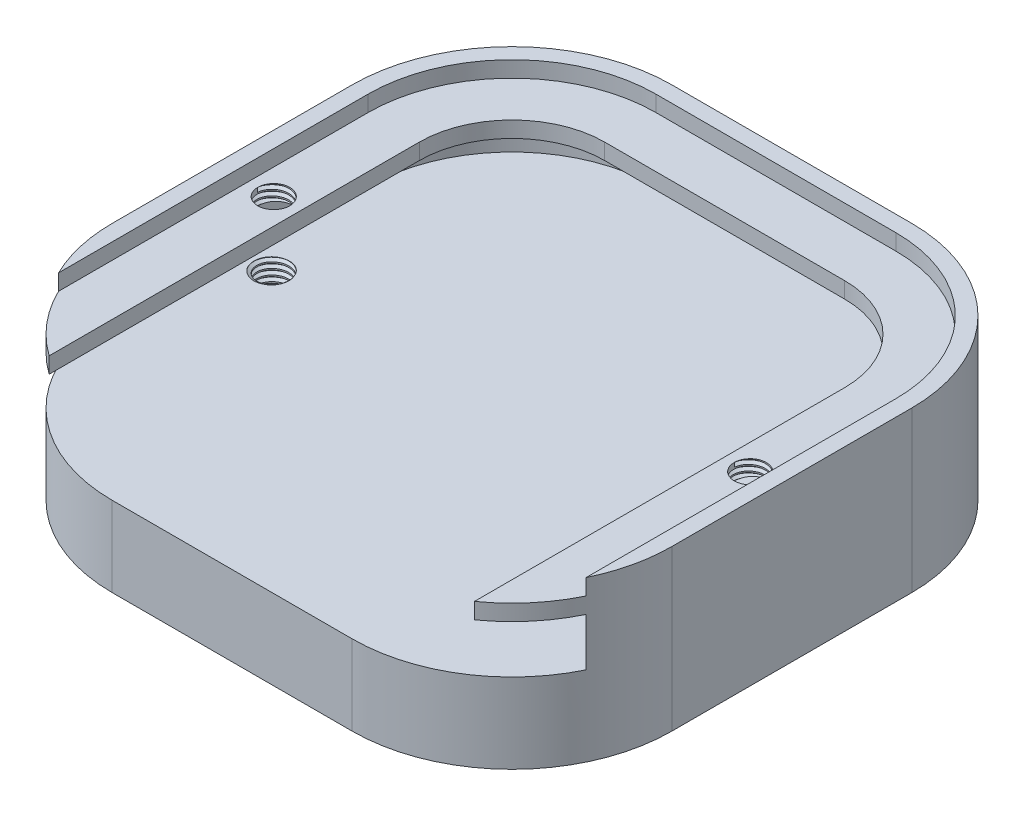
from build123d import *
from build123d.topology import SkipClean

# Parameters (mm, degrees)
BOSS_EXTRUDE1_DEPTH = 6.35
BOSS_EXTRUDE2_DEPTH = 6.35
BOSS_EXTRUDE3_START = -2.54
BOSS_EXTRUDE3_DEPTH = 1.27
SKETCH5_R           = 1.27
CUT_EXTRUDE2_DEPTH  = 10.16
THREAD4_PITCH       = 0.453571429
THREAD5_PITCH       = 0.453571429


with BuildPart() as part:
    # Sketch2 → Boss-Extrude1 (new body)
    with BuildSketch(Plane(origin=(0, 0, 0), x_dir=(1, 0, 0), z_dir=(0, 1, 0))):
        with BuildLine():
            Line((-9.525, 22.225), (9.525, 22.225))
            ThreePointArc((9.525, 22.225), (18.505256121, 18.505256121), (22.225, 9.525))
            Line((22.225, 9.525), (22.225, -9.525))
            ThreePointArc((22.225, -9.525), (18.505256121, -18.505256121), (9.525, -22.225))
            Line((9.525, -22.225), (-9.525, -22.225))
            ThreePointArc((-9.525, -22.225), (-18.505256121, -18.505256121), (-22.225, -9.525))
            Line((-22.225, -9.525), (-22.225, 9.525))
            ThreePointArc((-22.225, 9.525), (-18.505256121, 18.505256121), (-9.525, 22.225))
        make_face()
    extrude(amount=BOSS_EXTRUDE1_DEPTH)

    # Sketch3 → Boss-Extrude2 (add)
    with BuildSketch(Plane(origin=(0, 6.35, 0), x_dir=(1, 0, 0), z_dir=(0, 1, 0))):
        with BuildLine():
            Line((-9.525, 22.225), (9.525, 22.225))
            ThreePointArc((9.525, 22.225), (18.505256121, 18.505256121), (22.225, 9.525))
            Line((22.225, 9.525), (22.225, -9.525))
            ThreePointArc((22.225, -9.525), (21.903428818, -12.364806331), (20.955, -15.060801658))
            Line((20.955, -15.060801658), (20.955, 9.525))
            ThreePointArc((20.955, 9.525), (17.607230509, 17.607230509), (9.525, 20.955))
            Line((9.525, 20.955), (-9.525, 20.955))
            ThreePointArc((-9.525, 20.955), (-17.607230509, 17.607230509), (-20.955, 9.525))
            Line((-20.955, 9.525), (-20.955, -15.060801658))
            ThreePointArc((-20.955, -15.060801658), (-21.903428818, -12.364806331), (-22.225, -9.525))
            Line((-22.225, -9.525), (-22.225, 9.525))
            ThreePointArc((-22.225, 9.525), (-18.505256121, 18.505256121), (-9.525, 22.225))
        make_face()
    extrude(amount=BOSS_EXTRUDE2_DEPTH)

    # Sketch4 → Boss-Extrude3 (add)
    with BuildSketch(Plane(origin=(0, 12.7, 0), x_dir=(1, 0, 0), z_dir=(0, 1, 0)).offset(BOSS_EXTRUDE3_START)):
        with BuildLine():
            Line((-20.955, -15.060801658), (-20.955, 9.525))
            ThreePointArc((-20.955, 9.525), (-17.607230509, 17.607230509), (-9.525, 20.955))
            Line((-9.525, 20.955), (9.525, 20.955))
            ThreePointArc((9.525, 20.955), (17.607230509, 17.607230509), (20.955, 9.525))
            Line((20.955, 9.525), (20.955, -15.060801658))
            ThreePointArc((20.955, -15.060801658), (19.225825444, -17.721583782), (16.891, -19.870629222))
            Line((16.891, -19.870629222), (16.891, 9.525))
            ThreePointArc((16.891, 9.525), (14.73354855, 14.73354855), (9.525, 16.891))
            Line((9.525, 16.891), (-9.525, 16.891))
            ThreePointArc((-9.525, 16.891), (-14.73354855, 14.73354855), (-16.891, 9.525))
            Line((-16.891, 9.525), (-16.891, -19.870629222))
            ThreePointArc((-16.891, -19.870629222), (-19.225825444, -17.721583782), (-20.955, -15.060801658))
        make_face()
    extrude(amount=BOSS_EXTRUDE3_DEPTH)

    # Sketch5 → Cut-Extrude2 (cut)
    with BuildSketch(Plane(origin=(0, 11.43, 0), x_dir=(1, 0, 0), z_dir=(0, 1, 0))):
        with Locations(Location((-18.923, 0, 0), (0, 0, 270))):
            Circle(SKETCH5_R)
        with Locations(Location((18.923, 0, 0), (0, 0, 270))):
            Circle(SKETCH5_R)
    extrude(amount=-CUT_EXTRUDE2_DEPTH, mode=Mode.SUBTRACT)

    # Thread4: the profile of Thread Profile4 profile screwed along a right-hand helix of 22.4 turns, 6 arcs to a turn; built about Z, then put on its axis
    with SkipClean():  # the faces are left unmerged after this step: merging them gives an invalid solid
        thread4_z = Axis((0, 0, 0), (0, 0, 1))
        thread4_corners = [(1.2697, 0, -0.000173205), (1.515502736, 0, 0.141741071), (1.515502736, 0, 0.198437499), (1.2697, 0, 0.340351775)]
        with BuildLine(mode=Mode.PRIVATE) as thread4_profile:
            Line(thread4_corners[0], thread4_corners[1])
            Line(thread4_corners[1], thread4_corners[2])
            Line(thread4_corners[2], thread4_corners[3])
            Line(thread4_corners[3], thread4_corners[0])
        thread4_cap = Face(thread4_profile.wire())
        thread4_turn_angles = [0, 30, 60, 90, 120, 150, 180, 210, 240, 270, 300, 330, 360]
        thread4_turn_weights = [1, 0.8660254037844387, 1, 0.8660254037844387, 1, 0.8660254037844387, 1, 0.8660254037844387, 1, 0.8660254037844387, 1, 0.8660254037844387, 1]
        thread4_turn_rails = [Edge.make_bspline([Vector(p[0], p[1], 0).rotate(thread4_z, thread4_turn_angles[k]) / thread4_turn_weights[k] + Vector(0, 0, p[2] + THREAD4_PITCH * thread4_turn_angles[k] / 360) for k in range(13)], [0, 0, 0, 1, 1, 2, 2, 3, 3, 4, 4, 5, 5, 6, 6, 6], 2, thread4_turn_weights) for p in thread4_corners]
        thread4_turn_sides = [Face.make_surface_from_curves(thread4_turn_rails[p[0]], thread4_turn_rails[p[1]]) for p in [(0, 1), (1, 2), (2, 3), (3, 0)]]
        thread4_last_angles = [7920, 7950, 7980, 8010, 8040, 8052, 8064]
        thread4_last_weights = [1, 0.8660254037844387, 1, 0.8660254037844387, 1, 0.978147600733804, 1]
        thread4_last_rails = [Edge.make_bspline([Vector(p[0], p[1], 0).rotate(thread4_z, thread4_last_angles[k]) / thread4_last_weights[k] + Vector(0, 0, p[2] + THREAD4_PITCH * thread4_last_angles[k] / 360) for k in range(7)], [0, 0, 0, 1, 1, 2, 2, 3, 3, 3], 2, thread4_last_weights) for p in thread4_corners]
        thread4_last_sides = [Face.make_surface_from_curves(thread4_last_rails[p[0]], thread4_last_rails[p[1]]) for p in [(0, 1), (1, 2), (2, 3), (3, 0)]]
        thread4 = Plane(origin=(-18.923, 11.43, 0), x_dir=(-1, 0, 0), z_dir=(0, -1, 0)) * Solid(Shell([*[p.moved(Location((0, 0, THREAD4_PITCH * i))) for i in range(22) for p in thread4_turn_sides], *thread4_last_sides, thread4_cap, thread4_cap.rotate(thread4_z, 8064).moved(Location((0, 0, THREAD4_PITCH * 8064 / 360)))]))
        add(thread4, mode=Mode.SUBTRACT)

    # Thread5: the profile of Thread Profile5 profile screwed along a right-hand helix of 22.4 turns, 6 arcs to a turn; built about Z, then put on its axis
    with SkipClean():  # the faces are left unmerged after this step: merging them gives an invalid solid
        thread5_z = Axis((0, 0, 0), (0, 0, 1))
        thread5_corners = [(1.2697, 0, -0.000173205), (1.515502736, 0, 0.141741071), (1.515502736, 0, 0.198437499), (1.2697, 0, 0.340351775)]
        with BuildLine(mode=Mode.PRIVATE) as thread5_profile:
            Line(thread5_corners[0], thread5_corners[1])
            Line(thread5_corners[1], thread5_corners[2])
            Line(thread5_corners[2], thread5_corners[3])
            Line(thread5_corners[3], thread5_corners[0])
        thread5_cap = Face(thread5_profile.wire())
        thread5_turn_angles = [0, 30, 60, 90, 120, 150, 180, 210, 240, 270, 300, 330, 360]
        thread5_turn_weights = [1, 0.8660254037844387, 1, 0.8660254037844387, 1, 0.8660254037844387, 1, 0.8660254037844387, 1, 0.8660254037844387, 1, 0.8660254037844387, 1]
        thread5_turn_rails = [Edge.make_bspline([Vector(p[0], p[1], 0).rotate(thread5_z, thread5_turn_angles[k]) / thread5_turn_weights[k] + Vector(0, 0, p[2] + THREAD5_PITCH * thread5_turn_angles[k] / 360) for k in range(13)], [0, 0, 0, 1, 1, 2, 2, 3, 3, 4, 4, 5, 5, 6, 6, 6], 2, thread5_turn_weights) for p in thread5_corners]
        thread5_turn_sides = [Face.make_surface_from_curves(thread5_turn_rails[p[0]], thread5_turn_rails[p[1]]) for p in [(0, 1), (1, 2), (2, 3), (3, 0)]]
        thread5_last_angles = [7920, 7950, 7980, 8010, 8040, 8052, 8064]
        thread5_last_weights = [1, 0.8660254037844387, 1, 0.8660254037844387, 1, 0.978147600733804, 1]
        thread5_last_rails = [Edge.make_bspline([Vector(p[0], p[1], 0).rotate(thread5_z, thread5_last_angles[k]) / thread5_last_weights[k] + Vector(0, 0, p[2] + THREAD5_PITCH * thread5_last_angles[k] / 360) for k in range(7)], [0, 0, 0, 1, 1, 2, 2, 3, 3, 3], 2, thread5_last_weights) for p in thread5_corners]
        thread5_last_sides = [Face.make_surface_from_curves(thread5_last_rails[p[0]], thread5_last_rails[p[1]]) for p in [(0, 1), (1, 2), (2, 3), (3, 0)]]
        thread5 = Plane(origin=(18.923, 11.43, 0), x_dir=(-1, 0, 0), z_dir=(0, -1, 0)) * Solid(Shell([*[p.moved(Location((0, 0, THREAD5_PITCH * i))) for i in range(22) for p in thread5_turn_sides], *thread5_last_sides, thread5_cap, thread5_cap.rotate(thread5_z, 8064).moved(Location((0, 0, THREAD5_PITCH * 8064 / 360)))]))
        add(thread5, mode=Mode.SUBTRACT)


solid = part.part
